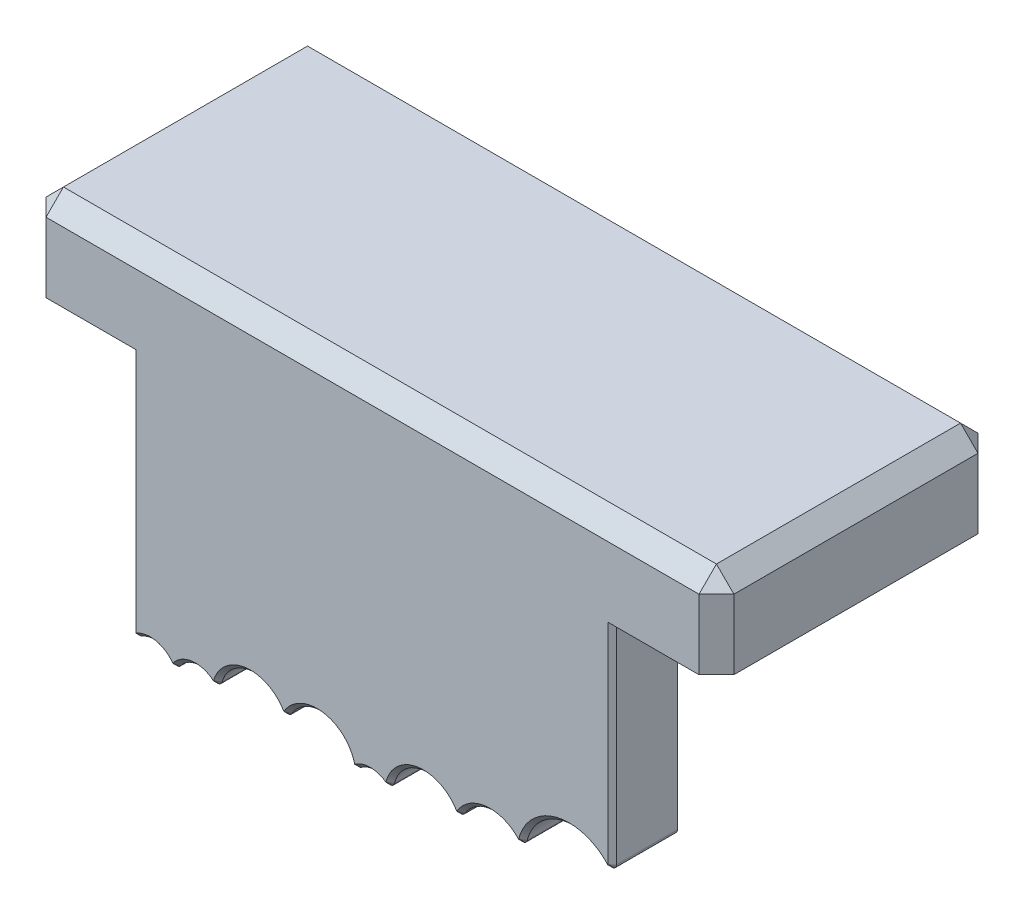
from build123d import *

# Parameters (mm, degrees)
SKETCH3_W           = 78.9
SKETCH3_H           = 32
BOSS_EXTRUDE1_DEPTH = 10
SKETCH3_4_R         = 2.375
CUT_EXTRUDE1_DEPTH  = 8
SKETCH4_W           = 55.14
SKETCH4_H           = 33.5
BOSS_EXTRUDE2_DEPTH = 8
CUT_EXTRUDE2_REACH  = 62.849
FILLET1_R           = 8
CHAMFER1_SIZE       = 2
CHAMFER2_SIZE       = 0.5


with BuildPart() as part:
    # Sketch3 → Boss-Extrude1 (new body)
    with BuildSketch(Plane(origin=(0, 0, 0), x_dir=(1, 0, 0), z_dir=(0, 1, 0))):
        with Locations((0, 16)):
            Rectangle(SKETCH3_W, SKETCH3_H)
    extrude(amount=BOSS_EXTRUDE1_DEPTH)

    # Sketch3<4> → Cut-Extrude1 (cut)
    with BuildSketch(Plane(origin=(0, 0, 0), x_dir=(1, 0, 0), z_dir=(0, 1, 0))):
        with Locations(Location((-34.45, 9.5, 0), (0, 0, 270))):
            Circle(SKETCH3_4_R)
        with Locations(Location((34.45, 9.5, 0), (0, 0, 270))):
            Circle(SKETCH3_4_R)
        with Locations(Location((-34.45, 25.5, 0), (0, 0, 270))):
            Circle(SKETCH3_4_R)
        with Locations(Location((34.45, 25.5, 0), (0, 0, 270))):
            Circle(SKETCH3_4_R)
    extrude(amount=CUT_EXTRUDE1_DEPTH, mode=Mode.SUBTRACT)

    # Sketch4 → Boss-Extrude2 (add)
    with BuildSketch(Plane.XY):
        with Locations((-0.082754798, -16.75)):
            Rectangle(SKETCH4_W, SKETCH4_H)
    extrude(amount=-BOSS_EXTRUDE2_DEPTH)

    # Sketch6 → Cut-Extrude2 (cut, up to next)
    with BuildSketch(Plane.XY, mode=Mode.PRIVATE) as cut_extrude2_sk1:
        with BuildLine():
            Line((-27.652754798, -33.5), (27.487245202, -33.5))
            Line((27.487245202, -33.5), (27.487245202, -24.11389297))
            ThreePointArc((27.487245202, -24.11389297), (27.167115928, -24.580418984), (26.616659115, -24.449550462))
            ThreePointArc((26.616659115, -24.449550462), (21.220888935, -22.815972253), (17.243633004, -26.811513376))
            ThreePointArc((17.243633004, -26.811513376), (16.881366116, -27.176161871), (16.388971366, -27.028672095))
            ThreePointArc((16.388971366, -27.028672095), (13.072861481, -25.77225608), (10.097455449, -27.701537013))
            ThreePointArc((10.097455449, -27.701537013), (9.665252059, -27.950140454), (9.23304867, -27.701537013))
            ThreePointArc((9.23304867, -27.701537013), (5.273342581, -25.791156717), (2.024915276, -28.753680172))
            ThreePointArc((2.024915276, -28.753680172), (1.710503102, -29.105939189), (1.243047888, -29.039403086))
            ThreePointArc((1.243047888, -29.039403086), (-0.250930092, -28.55), (-1.744908072, -29.039403086))
            ThreePointArc((-1.744908072, -29.039403086), (-2.212363286, -29.105939189), (-2.526775459, -28.753680172))
            ThreePointArc((-2.526775459, -28.753680172), (-5.775202765, -25.791156717), (-9.734908853, -27.701537013))
            ThreePointArc((-9.734908853, -27.701537013), (-10.167112243, -27.950140454), (-10.599315633, -27.701537013))
            ThreePointArc((-10.599315633, -27.701537013), (-14.473243405, -25.779600431), (-17.763117677, -28.586357258))
            ThreePointArc((-17.763117677, -28.586357258), (-18.097629496, -28.925925167), (-18.564711553, -28.830852177))
            ThreePointArc((-18.564711553, -28.830852177), (-20.636908569, -28.221196647), (-22.493001056, -29.326004785))
            ThreePointArc((-22.493001056, -29.326004785), (-22.899251056, -29.534524189), (-23.305501056, -29.326004785))
            ThreePointArc((-23.305501056, -29.326004785), (-24.955684592, -28.255281584), (-26.894394838, -28.588382855))
            ThreePointArc((-26.894394838, -28.588382855), (-27.398539277, -28.595724932), (-27.652754798, -28.160305606))
            Line((-27.652754798, -28.160305606), (-27.652754798, -33.5))
        make_face()
    cut_extrude2_tool1 = extrude(cut_extrude2_sk1.sketch, amount=-CUT_EXTRUDE2_REACH, mode=Mode.PRIVATE) & part.part
    add(cut_extrude2_tool1.solids().sort_by_distance((2.915251, -29.773814, 0))[0], mode=Mode.SUBTRACT)

    # Fillet1
    fillet1_edges = [part.edges().sort_by_distance(p)[0] for p in [
        (-0.082754798, 0, -8),
    ]]
    fillet(fillet1_edges, radius=FILLET1_R)

    # Chamfer1
    chamfer1_edges = [part.edges().sort_by_distance(p)[0] for p in [
        (39.45, 10, -16),
        (0, 10, 0),
        (-39.45, 10, -16),
        (0, 10, -32),
        (-39.45, 5, 0),
        (39.45, 5, 0),
        (39.45, 5, -32),
        (-39.45, 5, -32),
    ]]
    chamfer(chamfer1_edges, length=CHAMFER1_SIZE)

    # Chamfer2
    # the kernel refuses this chamfer: 0.5 mm, written as the material it takes off along each edge
    with BuildSketch(Plane(origin=(-27.652754798, -28.160305606, -8), x_dir=(0, 0, 1), z_dir=(0, 1, 0))) as chamfer2_piece_1:
        Polygon((CHAMFER2_SIZE, 0), (0, CHAMFER2_SIZE), (0, 0), align=None)
    extrude(amount=20.160305606, mode=Mode.SUBTRACT)
    with BuildSketch(Plane(origin=(-27.652754798, -8, -16), x_dir=(0, 0.8858914010009324, -0.4638926876257108), z_dir=(0, -0.4638926876257108, -0.8858914010009324))) as chamfer2_piece_2_section:
        Polygon((8 + CHAMFER2_SIZE, 0), (8, CHAMFER2_SIZE), (8, 0), align=None)
    chamfer2_piece_2 = revolve(axis=Axis((-27.652754798, -8, -16), (1, 0, 0)), revolution_arc=117.638582209, mode=Mode.PRIVATE)
    chamfer2_piece_2 = split(chamfer2_piece_2, bisect_by=Plane(origin=(-27.652754798, 0, -16), z_dir=(0, -1, 0)), keep=Keep.TOP, mode=Mode.PRIVATE)
    add(chamfer2_piece_2, mode=Mode.SUBTRACT)
    with BuildSketch(Plane(origin=(27.487245202, -8, -16), x_dir=(0, 0.8858914010009324, -0.4638926876257108), z_dir=(0, -0.4638926876257108, -0.8858914010009324))) as chamfer2_piece_3_section:
        Polygon((8, -CHAMFER2_SIZE), (8 + CHAMFER2_SIZE, 0), (8, 0), align=None)
    chamfer2_piece_3 = revolve(axis=Axis((27.487245202, -8, -16), (1, 0, 0)), revolution_arc=117.638582209, mode=Mode.PRIVATE)
    chamfer2_piece_3 = split(chamfer2_piece_3, bisect_by=Plane(origin=(27.487245202, 0, -16), z_dir=(0, -1, 0)), keep=Keep.TOP, mode=Mode.PRIVATE)
    add(chamfer2_piece_3, mode=Mode.SUBTRACT)
    with BuildSketch(Plane(origin=(-27.652754798, -28.160305606, 0), x_dir=(1, 0, 0), z_dir=(0, 1, 0))) as chamfer2_piece_4:
        Polygon((CHAMFER2_SIZE, 0), (0, CHAMFER2_SIZE), (0, 0), align=None)
    extrude(amount=28.160305606, mode=Mode.SUBTRACT)
    with BuildSketch(Plane(origin=(27.487245202, -8, -8), x_dir=(0, 0, 1), z_dir=(0, -1, 0))) as chamfer2_piece_5:
        Polygon((CHAMFER2_SIZE, 0), (0, CHAMFER2_SIZE), (0, 0), align=None)
    extrude(amount=16.11389297, mode=Mode.SUBTRACT)
    with BuildSketch(Plane(origin=(27.487245202, 0, 0), x_dir=(-1, 0, 0), z_dir=(0, -1, 0))) as chamfer2_piece_6:
        Polygon((CHAMFER2_SIZE, 0), (0, CHAMFER2_SIZE), (0, 0), align=None)
    extrude(amount=24.11389297, mode=Mode.SUBTRACT)
    with BuildSketch(Plane(origin=(-18.243500534, -28.447676654, -8), x_dir=(-0.6424220378621972, -0.7663510457153313, 0), z_dir=(-0.7663510457153313, 0.6424220378621972, 0))) as chamfer2_piece_7:
        Polygon((0.5, CHAMFER2_SIZE), (0.5 - CHAMFER2_SIZE, 0), (0.5, 0), align=None)
    revolve(axis=Axis((-18.243500534, -28.447676654, -8), (0, 0, 1)), revolution_arc=113.869886465, mode=Mode.SUBTRACT)
    with BuildSketch(Plane(origin=(-13.992112243, -29.675, -8), x_dir=(0.8644067796610168, 0.5027931177691978, 0), z_dir=(0.5027931177691978, -0.8644067796610168, 0))) as chamfer2_piece_8:
        Polygon((3.925, CHAMFER2_SIZE), (3.925 + CHAMFER2_SIZE, 0), (3.925, 0), align=None)
    revolve(axis=Axis((-13.992112243, -29.675, -8), (0, 0, 1)), revolution_arc=133.712259818, mode=Mode.SUBTRACT)
    with BuildSketch(Plane(origin=(-10.167112243, -27.450140454, -8), x_dir=(-0.8644067796610185, -0.5027931177691948, 0), z_dir=(-0.5027931177691948, 0.8644067796610185, 0))) as chamfer2_piece_9:
        Polygon((0.5, CHAMFER2_SIZE), (0.5 - CHAMFER2_SIZE, 0), (0.5, 0), align=None)
    revolve(axis=Axis((-10.167112243, -27.450140454, -8), (0, 0, 1)), revolution_arc=119.63007225, mode=Mode.SUBTRACT)
    with BuildSketch(Plane(origin=(-6.342112243, -29.675, -8), x_dir=(0.9720603270931867, 0.23473116642552358, 0), z_dir=(0.23473116642552358, -0.9720603270931867, 0))) as chamfer2_piece_10:
        Polygon((3.925, CHAMFER2_SIZE), (3.925 + CHAMFER2_SIZE, 0), (3.925, 0), align=None)
    revolve(axis=Axis((-6.342112243, -29.675, -8), (0, 0, 1)), revolution_arc=136.239259635, mode=Mode.SUBTRACT)
    with BuildSketch(Plane(origin=(-2.040745296, -28.636314589, -8), x_dir=(-0.9720603270931848, -0.23473116642553216, 0), z_dir=(-0.23473116642553216, 0.9720603270931848, 0))) as chamfer2_piece_11:
        Polygon((0.5, CHAMFER2_SIZE), (0.5 - CHAMFER2_SIZE, 0), (0.5, 0), align=None)
    revolve(axis=Axis((-2.040745296, -28.636314589, -8), (0, 0, 1)), revolution_arc=112.700145839, mode=Mode.SUBTRACT)
    with BuildSketch(Plane(origin=(-0.250930092, -31.075, -8), x_dir=(0.5916744475658624, 0.8061769955150243, 0), z_dir=(0.8061769955150243, -0.5916744475658624, 0))) as chamfer2_piece_12:
        Polygon((2.525, CHAMFER2_SIZE), (2.525 + CHAMFER2_SIZE, 0), (2.525, 0), align=None)
    revolve(axis=Axis((-0.250930092, -31.075, -8), (0, 0, 1)), revolution_arc=72.551844659, mode=Mode.SUBTRACT)
    with BuildSketch(Plane(origin=(1.538885112, -28.636314589, -8), x_dir=(-0.5916744475658654, -0.8061769955150222, 0), z_dir=(-0.8061769955150222, 0.5916744475658654, 0))) as chamfer2_piece_13:
        Polygon((0.5, CHAMFER2_SIZE), (0.5 - CHAMFER2_SIZE, 0), (0.5, 0), align=None)
    revolve(axis=Axis((1.538885112, -28.636314589, -8), (0, 0, 1)), revolution_arc=112.700145839, mode=Mode.SUBTRACT)
    with BuildSketch(Plane(origin=(5.840252059, -29.675, -8), x_dir=(0.864406779661017, 0.5027931177691973, 0), z_dir=(0.5027931177691973, -0.864406779661017, 0))) as chamfer2_piece_14:
        Polygon((3.925, CHAMFER2_SIZE), (3.925 + CHAMFER2_SIZE, 0), (3.925, 0), align=None)
    revolve(axis=Axis((5.840252059, -29.675, -8), (0, 0, 1)), revolution_arc=136.239259635, mode=Mode.SUBTRACT)
    with BuildSketch(Plane(origin=(9.665252059, -27.450140454, -8), x_dir=(-0.8644067796610146, -0.5027931177692017, 0), z_dir=(-0.5027931177692017, 0.8644067796610146, 0))) as chamfer2_piece_15:
        Polygon((0.5, CHAMFER2_SIZE), (0.5 - CHAMFER2_SIZE, 0), (0.5, 0), align=None)
    revolve(axis=Axis((9.665252059, -27.450140454, -8), (0, 0, 1)), revolution_arc=119.63007225, mode=Mode.SUBTRACT)
    with BuildSketch(Plane(origin=(13.490252059, -29.675, -8), x_dir=(0.7385272118911914, 0.6742236700800583, 0), z_dir=(0.6742236700800583, -0.7385272118911914, 0))) as chamfer2_piece_16:
        Polygon((3.925, CHAMFER2_SIZE), (3.925 + CHAMFER2_SIZE, 0), (3.925, 0), align=None)
    revolve(axis=Axis((13.490252059, -29.675, -8), (0, 0, 1)), revolution_arc=107.421143416, mode=Mode.SUBTRACT)
    with BuildSketch(Plane(origin=(16.758234972, -26.69156026, -8), x_dir=(-0.7385272118911994, -0.6742236700800496, 0), z_dir=(-0.6742236700800496, 0.7385272118911994, 0))) as chamfer2_piece_17:
        Polygon((0.5, CHAMFER2_SIZE), (0.5 - CHAMFER2_SIZE, 0), (0.5, 0), align=None)
    revolve(axis=Axis((16.758234972, -26.69156026, -8), (0, 0, 1)), revolution_arc=123.725101084, mode=Mode.SUBTRACT)
    with BuildSketch(Plane(origin=(22.55874146, -28.125, -8), x_dir=(0.7411721744642813, 0.6713149840424306, 0), z_dir=(0.6713149840424306, -0.7411721744642813, 0))) as chamfer2_piece_18:
        Polygon((5.475, CHAMFER2_SIZE), (5.475 + CHAMFER2_SIZE, 0), (5.475, 0), align=None)
    revolve(axis=Axis((22.55874146, -28.125, -8), (0, 0, 1)), revolution_arc=123.950356593, mode=Mode.SUBTRACT)
    with BuildSketch(Plane(origin=(26.987245202, -24.11389297, -8), x_dir=(-0.7411721744642809, -0.6713149840424313, 0), z_dir=(-0.6713149840424313, 0.7411721744642809, 0))) as chamfer2_piece_19:
        Polygon((0.5, CHAMFER2_SIZE), (0.5 - CHAMFER2_SIZE, 0), (0.5, 0), align=None)
    revolve(axis=Axis((26.987245202, -24.11389297, -8), (0, 0, 1)), revolution_arc=137.831362799, mode=Mode.SUBTRACT)
    with BuildSketch(Plane(origin=(-27.152754798, -28.160305606, -8), x_dir=(-1, 0, 0), z_dir=(0, 1, 0))) as chamfer2_piece_20:
        Polygon((0.5, CHAMFER2_SIZE), (0.5 - CHAMFER2_SIZE, 0), (0.5, 0), align=None)
    revolve(axis=Axis((-27.152754798, -28.160305606, -8), (0, 0, 1)), revolution_arc=121.112486243, mode=Mode.SUBTRACT)
    with BuildSketch(Plane(origin=(-25.499251056, -30.9, -8), x_dir=(0.8125000000000023, 0.5829611908180474, 0), z_dir=(0.5829611908180474, -0.8125000000000023, 0))) as chamfer2_piece_21:
        Polygon((2.7, CHAMFER2_SIZE), (2.7 + CHAMFER2_SIZE, 0), (2.7, 0), align=None)
    revolve(axis=Axis((-25.499251056, -30.9, -8), (0, 0, 1)), revolution_arc=85.453398547, mode=Mode.SUBTRACT)
    with BuildSketch(Plane(origin=(-22.899251056, -29.034524189, -8), x_dir=(-0.8124999999999996, -0.5829611908180515, 0), z_dir=(-0.5829611908180515, 0.8124999999999996, 0))) as chamfer2_piece_22:
        Polygon((0.5, CHAMFER2_SIZE), (0.5 - CHAMFER2_SIZE, 0), (0.5, 0), align=None)
    revolve(axis=Axis((-22.899251056, -29.034524189, -8), (0, 0, 1)), revolution_arc=108.681824608, mode=Mode.SUBTRACT)
    with BuildSketch(Plane(origin=(-20.299251056, -30.9, -8), x_dir=(0.6424220378622064, 0.7663510457153235, 0), z_dir=(0.7663510457153235, -0.6424220378622064, 0))) as chamfer2_piece_23:
        Polygon((2.7, CHAMFER2_SIZE), (2.7 + CHAMFER2_SIZE, 0), (2.7, 0), align=None)
    revolve(axis=Axis((-20.299251056, -30.9, -8), (0, 0, 1)), revolution_arc=94.313575076, mode=Mode.SUBTRACT)
    with BuildSketch(Plane(origin=(-18.243500534, -28.447676654, 0), x_dir=(0.9607657155546954, -0.2773612082009208, 0), z_dir=(0.2773612082009208, 0.9607657155546954, 0))) as chamfer2_piece_24:
        Polygon((0.5 - CHAMFER2_SIZE, 0), (0.5, CHAMFER2_SIZE), (0.5, 0), align=None)
    revolve(axis=Axis((-18.243500534, -28.447676654, 0), (0, 0, -1)), revolution_arc=113.869886465, mode=Mode.SUBTRACT)
    with BuildSketch(Plane(origin=(-20.299251056, -30.9, 0), x_dir=(0.6424220378622064, 0.7663510457153235, 0), z_dir=(0.7663510457153235, -0.6424220378622064, 0))) as chamfer2_piece_25:
        Polygon((2.7 + CHAMFER2_SIZE, 0), (2.7, -CHAMFER2_SIZE), (2.7, 0), align=None)
    revolve(axis=Axis((-20.299251056, -30.9, 0), (0, 0, 1)), revolution_arc=94.313575076, mode=Mode.SUBTRACT)
    with BuildSketch(Plane(origin=(-22.899251056, -29.034524189, 0), x_dir=(0.812500000000002, -0.5829611908180482, 0), z_dir=(0.5829611908180482, 0.812500000000002, 0))) as chamfer2_piece_26:
        Polygon((0.5 - CHAMFER2_SIZE, 0), (0.5, CHAMFER2_SIZE), (0.5, 0), align=None)
    revolve(axis=Axis((-22.899251056, -29.034524189, 0), (0, 0, -1)), revolution_arc=108.681824608, mode=Mode.SUBTRACT)
    with BuildSketch(Plane(origin=(-25.499251056, -30.9, 0), x_dir=(0.8125000000000023, 0.5829611908180474, 0), z_dir=(0.5829611908180474, -0.8125000000000023, 0))) as chamfer2_piece_27:
        Polygon((2.7 + CHAMFER2_SIZE, 0), (2.7, -CHAMFER2_SIZE), (2.7, 0), align=None)
    revolve(axis=Axis((-25.499251056, -30.9, 0), (0, 0, 1)), revolution_arc=85.453398547, mode=Mode.SUBTRACT)
    with BuildSketch(Plane(origin=(-27.152754798, -28.160305606, 0), x_dir=(0.5167199195075316, -0.8561544981976853, 0), z_dir=(0.8561544981976853, 0.5167199195075316, 0))) as chamfer2_piece_28:
        Polygon((0.5 - CHAMFER2_SIZE, 0), (0.5, CHAMFER2_SIZE), (0.5, 0), align=None)
    revolve(axis=Axis((-27.152754798, -28.160305606, 0), (0, 0, -1)), revolution_arc=121.112486243, mode=Mode.SUBTRACT)
    with BuildSketch(Plane(origin=(26.987245202, -24.11389297, 0), x_dir=(1, 0, 0), z_dir=(0, 1, 0))) as chamfer2_piece_29:
        Polygon((0.5 - CHAMFER2_SIZE, 0), (0.5, CHAMFER2_SIZE), (0.5, 0), align=None)
    revolve(axis=Axis((26.987245202, -24.11389297, 0), (0, 0, -1)), revolution_arc=137.831362799, mode=Mode.SUBTRACT)
    with BuildSketch(Plane(origin=(22.55874146, -28.125, 0), x_dir=(0.7411721744642813, 0.6713149840424306, 0), z_dir=(0.6713149840424306, -0.7411721744642813, 0))) as chamfer2_piece_30:
        Polygon((5.475 + CHAMFER2_SIZE, 0), (5.475, -CHAMFER2_SIZE), (5.475, 0), align=None)
    revolve(axis=Axis((22.55874146, -28.125, 0), (0, 0, 1)), revolution_arc=123.950356593, mode=Mode.SUBTRACT)
    with BuildSketch(Plane(origin=(16.758234972, -26.69156026, 0), x_dir=(0.9707960648529864, -0.23990623265341857, 0), z_dir=(0.23990623265341857, 0.9707960648529864, 0))) as chamfer2_piece_31:
        Polygon((0.5 - CHAMFER2_SIZE, 0), (0.5, CHAMFER2_SIZE), (0.5, 0), align=None)
    revolve(axis=Axis((16.758234972, -26.69156026, 0), (0, 0, -1)), revolution_arc=123.725101084, mode=Mode.SUBTRACT)
    with BuildSketch(Plane(origin=(13.490252059, -29.675, 0), x_dir=(0.7385272118911914, 0.6742236700800583, 0), z_dir=(0.6742236700800583, -0.7385272118911914, 0))) as chamfer2_piece_32:
        Polygon((3.925 + CHAMFER2_SIZE, 0), (3.925, -CHAMFER2_SIZE), (3.925, 0), align=None)
    revolve(axis=Axis((13.490252059, -29.675, 0), (0, 0, 1)), revolution_arc=107.421143416, mode=Mode.SUBTRACT)
    with BuildSketch(Plane(origin=(9.665252059, -27.450140454, 0), x_dir=(0.8644067796610185, -0.5027931177691948, 0), z_dir=(0.5027931177691948, 0.8644067796610185, 0))) as chamfer2_piece_33:
        Polygon((0.5 - CHAMFER2_SIZE, 0), (0.5, CHAMFER2_SIZE), (0.5, 0), align=None)
    revolve(axis=Axis((9.665252059, -27.450140454, 0), (0, 0, -1)), revolution_arc=119.63007225, mode=Mode.SUBTRACT)
    with BuildSketch(Plane(origin=(5.840252059, -29.675, 0), x_dir=(0.864406779661017, 0.5027931177691973, 0), z_dir=(0.5027931177691973, -0.864406779661017, 0))) as chamfer2_piece_34:
        Polygon((3.925 + CHAMFER2_SIZE, 0), (3.925, -CHAMFER2_SIZE), (3.925, 0), align=None)
    revolve(axis=Axis((5.840252059, -29.675, 0), (0, 0, 1)), revolution_arc=136.239259635, mode=Mode.SUBTRACT)
    with BuildSketch(Plane(origin=(1.538885112, -28.636314589, 0), x_dir=(0.9720603270931909, -0.23473116642550618, 0), z_dir=(0.23473116642550618, 0.9720603270931909, 0))) as chamfer2_piece_35:
        Polygon((0.5 - CHAMFER2_SIZE, 0), (0.5, CHAMFER2_SIZE), (0.5, 0), align=None)
    revolve(axis=Axis((1.538885112, -28.636314589, 0), (0, 0, -1)), revolution_arc=112.700145839, mode=Mode.SUBTRACT)
    with BuildSketch(Plane(origin=(-0.250930092, -31.075, 0), x_dir=(0.5916744475658624, 0.8061769955150243, 0), z_dir=(0.8061769955150243, -0.5916744475658624, 0))) as chamfer2_piece_36:
        Polygon((2.525 + CHAMFER2_SIZE, 0), (2.525, -CHAMFER2_SIZE), (2.525, 0), align=None)
    revolve(axis=Axis((-0.250930092, -31.075, 0), (0, 0, 1)), revolution_arc=72.551844659, mode=Mode.SUBTRACT)
    with BuildSketch(Plane(origin=(-2.040745296, -28.636314589, 0), x_dir=(0.5916744475658575, -0.8061769955150281, 0), z_dir=(0.8061769955150281, 0.5916744475658575, 0))) as chamfer2_piece_37:
        Polygon((0.5 - CHAMFER2_SIZE, 0), (0.5, CHAMFER2_SIZE), (0.5, 0), align=None)
    revolve(axis=Axis((-2.040745296, -28.636314589, 0), (0, 0, -1)), revolution_arc=112.700145839, mode=Mode.SUBTRACT)
    with BuildSketch(Plane(origin=(-6.342112243, -29.675, 0), x_dir=(0.9720603270931867, 0.23473116642552358, 0), z_dir=(0.23473116642552358, -0.9720603270931867, 0))) as chamfer2_piece_38:
        Polygon((3.925 + CHAMFER2_SIZE, 0), (3.925, -CHAMFER2_SIZE), (3.925, 0), align=None)
    revolve(axis=Axis((-6.342112243, -29.675, 0), (0, 0, 1)), revolution_arc=136.239259635, mode=Mode.SUBTRACT)
    with BuildSketch(Plane(origin=(-10.167112243, -27.450140454, 0), x_dir=(0.8644067796610155, -0.5027931177692001, 0), z_dir=(0.5027931177692001, 0.8644067796610155, 0))) as chamfer2_piece_39:
        Polygon((0.5 - CHAMFER2_SIZE, 0), (0.5, CHAMFER2_SIZE), (0.5, 0), align=None)
    revolve(axis=Axis((-10.167112243, -27.450140454, 0), (0, 0, -1)), revolution_arc=119.63007225, mode=Mode.SUBTRACT)
    with BuildSketch(Plane(origin=(-13.992112243, -29.675, 0), x_dir=(0.8644067796610168, 0.5027931177691978, 0), z_dir=(0.5027931177691978, -0.8644067796610168, 0))) as chamfer2_piece_40:
        Polygon((3.925 + CHAMFER2_SIZE, 0), (3.925, -CHAMFER2_SIZE), (3.925, 0), align=None)
    revolve(axis=Axis((-13.992112243, -29.675, 0), (0, 0, 1)), revolution_arc=133.712259818, mode=Mode.SUBTRACT)


solid = part.part
